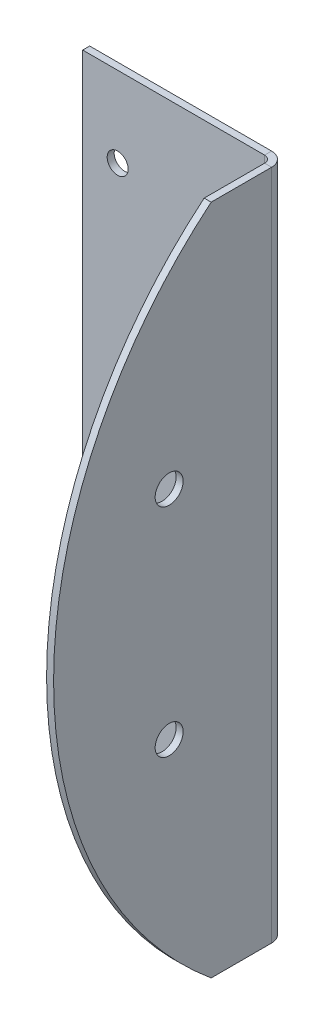
from build123d import *

# Parameters (mm, degrees)
IZIM1_W                     = 27
IZIM1_H                     = 96
IZIM1_R                     = 1.5
IZIM1_R_2                   = 2
Y_KSEKLIK_EKSTR_ZYON1_DEPTH = 1
IZGIDEN_START               = 367.447539798
IZGIDEN_B_KME1_OUTLINE_W    = 96
IZGIDEN_B_KME1_OUTLINE_H    = 1
IZGIDEN_B_KME1_DEPTH        = 32.552460202
IZGIDEN_START_2             = 365.658779798
IZGIDEN_B_KME1_2_OUTLINE_R  = 2
IZGIDEN_B_KME1_2_DEPTH      = 2
IZGIDEN_START_3             = -15.757423971
IZGIDEN_B_KME1_3_DEPTH      = 96


with BuildPart() as part:
    # Çizim1 → Yükseklik-Ekstrüzyon1 (new body)
    # profile 1 of 2: a face of its own
    with BuildSketch(Plane.XY):
        with Locations((353.158779798, 32.242576029)):
            Rectangle(IZIM1_W, IZIM1_H)
        with Locations((344.658779798, -4.257423971)):
            Circle(IZIM1_R, mode=Mode.SUBTRACT)
        with Locations((344.658779798, 68.742576029)):
            Circle(IZIM1_R, mode=Mode.SUBTRACT)
    # profile 2 of 2: a face of its own
    with BuildSketch(Plane.XY):
        with BuildLine():
            Line((376.658779798, 80.242576029), (366.658779798, 80.242576029))
            Line((366.658779798, 80.242576029), (366.658779798, -15.757423971))
            Line((366.658779798, -15.757423971), (376.658779798, -15.757423971))
            ThreePointArc((376.658779798, -15.757423971), (399.170626089, 32.242576029), (376.658779798, 80.242576029))
        make_face()
        with Locations((382.658779798, 16.742576029)):
            Circle(IZIM1_R_2, mode=Mode.SUBTRACT)
        with Locations((382.658779798, 47.742576029)):
            Circle(IZIM1_R_2, mode=Mode.SUBTRACT)
    extrude(amount=Y_KSEKLIK_EKSTR_ZYON1_DEPTH)

    # Çizgiden Bükme1: read off the stored shape, not the designer's step
    # Çizgiden Bükme1 outline → Çizgiden Bükme1 (cut)
    with BuildSketch(Plane.YZ.offset(IZGIDEN_START)):
        with Locations((32.242576029, 0.5)):
            Rectangle(IZGIDEN_B_KME1_OUTLINE_W, IZGIDEN_B_KME1_OUTLINE_H)
    extrude(amount=IZGIDEN_B_KME1_DEPTH, mode=Mode.SUBTRACT)

    # izgiden B_kme1 2 outline → izgiden B_kme1 2 (add)
    with BuildSketch(Plane.YZ.offset(IZGIDEN_START_2)):
        with BuildLine():
            Line((80.242576029, 1), (80.242576029, 10.64380551))
            ThreePointArc((80.242576029, 10.64380551), (32.242576029, 33.155651801), (-15.757423971, 10.64380551))
            Line((-15.757423971, 10.64380551), (-15.757423971, 1))
            Line((-15.757423971, 1), (80.242576029, 1))
        make_face()
        with Locations((16.742576029, 16.64380551)):
            Circle(IZGIDEN_B_KME1_2_OUTLINE_R, mode=Mode.SUBTRACT)
        with Locations((47.742576029, 16.64380551)):
            Circle(IZGIDEN_B_KME1_2_OUTLINE_R, mode=Mode.SUBTRACT)
    extrude(amount=IZGIDEN_B_KME1_2_DEPTH)

    # izgiden B_kme1 3 outline → izgiden B_kme1 3 (cut)
    with BuildSketch(Plane(origin=(0, 0, 0), x_dir=(1, 0, 0), z_dir=(0, 1, 0)).offset(IZGIDEN_START_3)):
        with BuildLine():
            Line((366.658779798, -35), (366.658779798, -2))
            ThreePointArc((366.658779798, -2), (366.365886579, -1.292893219), (365.658779798, -1))
            Line((365.658779798, -1), (365.658779798, -35))
            Line((365.658779798, -35), (366.658779798, -35))
        make_face()
        with BuildLine():
            Line((367.658779798, -2), (367.658779819, -35))
            Line((367.658779819, -35), (369, -35))
            Line((369, -35), (369, -1))
            Line((369, -1), (367.447539798, -1))
            Line((367.447539798, -1), (367.447539798, 1))
            Line((367.447539798, 1), (364, 1))
            Line((364, 1), (364, 1e-09))
            Line((364, 1e-09), (365.658779798, 0))
            ThreePointArc((365.658779798, 0), (367.07299336, -0.585786438), (367.658779798, -2))
        make_face()
    extrude(amount=IZGIDEN_B_KME1_3_DEPTH, mode=Mode.SUBTRACT)


solid = part.part
